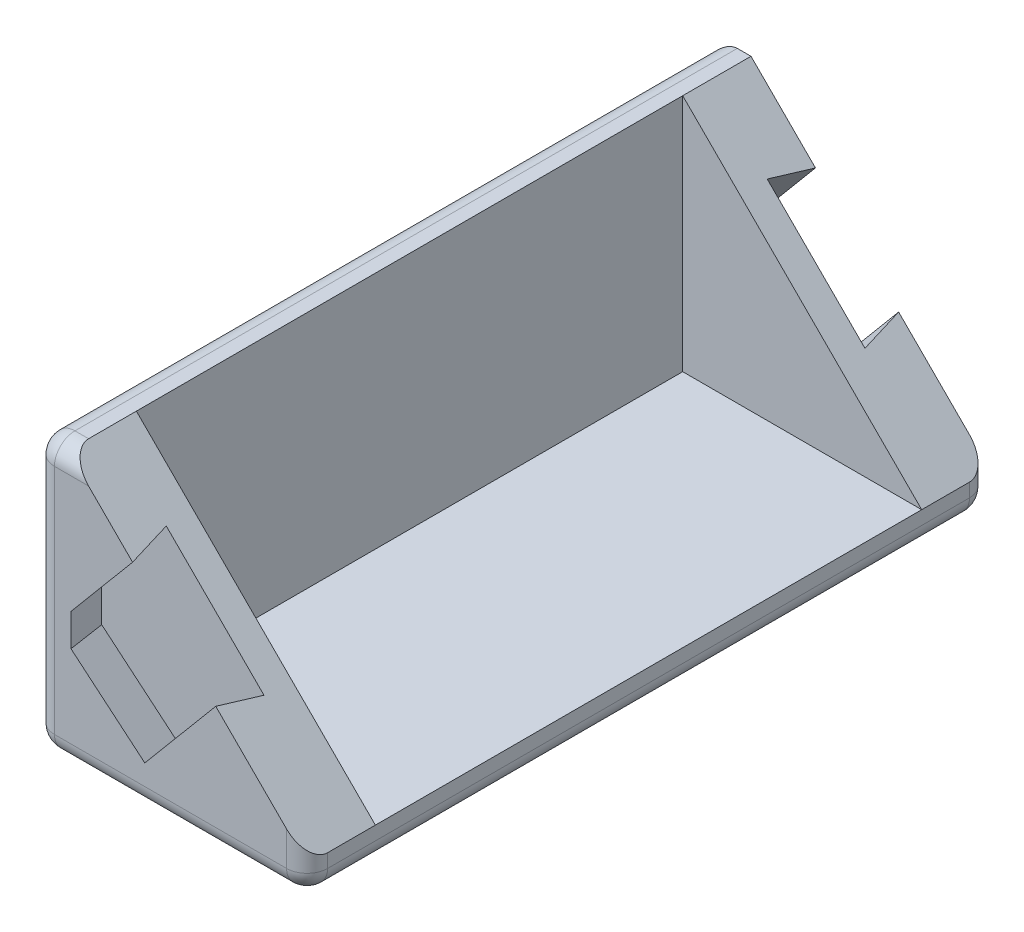
from build123d import *

# Parameters (mm, degrees)
EXTRUDE_1_DEPTH = 10
EXTRUDE_3_DEPTH = 40
FILLET_2_R      = 3
FILLET_3_R      = 3


with BuildPart() as part:
    # 草图3 → 凸台-拉伸1 (new body)
    with BuildSketch(Plane.XY):
        Polygon((-100, -79.175359259), (-100, -119.175359259), (-60, -119.175359259), (-60, -114.175359259), (-95, -79.175359259), align=None)
    extrude(amount=-EXTRUDE_1_DEPTH)

    # 草图5 → 切除-放样1 section 0
    with BuildSketch(Plane.XY.offset(-6)):
        with BuildLine():
            Line((-96.08, -104.799041882), (-96.08, -98.821989002))
            Line((-96.08, -98.821989002), (-81.709132385, -81.695455893))
            Line((-81.709132385, -81.695455893), (-66.265676412, -94.654054104))
            Line((-66.265676412, -94.654054104), (-83.579668035, -115.288065824))
            Line((-83.579668035, -115.288065824), (-96.08, -104.799041882))
        make_face()
    # 草图8 → 切除-放样1 section 1
    with BuildSketch(Plane.XY):
        with BuildLine():
            Line((-94.58, -104.099580395), (-94.58, -99.367944353))
            Line((-94.58, -99.367944353), (-80.56006572, -82.659637307))
            Line((-80.56006572, -82.659637307), (-67.414743077, -93.68987269))
            Line((-67.414743077, -93.68987269), (-83.764553285, -113.174817744))
            Line((-83.764553285, -113.174817744), (-94.58, -104.099580395))
        make_face()
    loft(mode=Mode.SUBTRACT)

    # 草图9 → 凸台-拉伸3 (add)
    with BuildSketch(Plane(origin=(0, 0, -10), x_dir=(-1, 0, 0), z_dir=(0, 0, -1))):
        Polygon((95, -79.175359259), (95, -114.175359259), (60, -114.175359259), (60, -119.175359259), (100, -119.175359259), (100, -79.175359259), align=None)
    extrude(amount=EXTRUDE_3_DEPTH)

    # 镜向2: part across plane


with BuildPart() as part_1:
    add(part.part)
    add(part.part.mirror(Plane(origin=(0, 0, -50), x_dir=(1, 0, 0), z_dir=(0, 0, -1))))

    # 圆角2
    fillet_2_edges = [part_1.edges().sort_by_distance(p)[0] for p in [
        (-60, -116.675359259, -100),
        (-60, -116.675359259, 0),
        (-100, -99.175359259, -100),
        (-100, -99.175359259, 0),
        (-100, -79.175359259, -50),
        (-97.5, -79.175359259, 0),
    ]]
    fillet(fillet_2_edges, radius=FILLET_2_R)

    # 圆角3
    fillet_3_edges = [part_1.edges().sort_by_distance(p)[0] for p in [
        (-80, -119.175359259, -100),
        (-80, -119.175359259, 0),
        (-100, -119.175359259, -50),
        (-60, -119.175359259, -50),
        (-99.121320344, -119.175359259, -0.878679656),
        (-99.121320344, -119.175359259, -99.121320344),
        (-60.878679656, -119.175359259, -0.878679656),
        (-60.878679656, -119.175359259, -99.121320344),
    ]]
    fillet(fillet_3_edges, radius=FILLET_3_R)


solid = part_1.part
